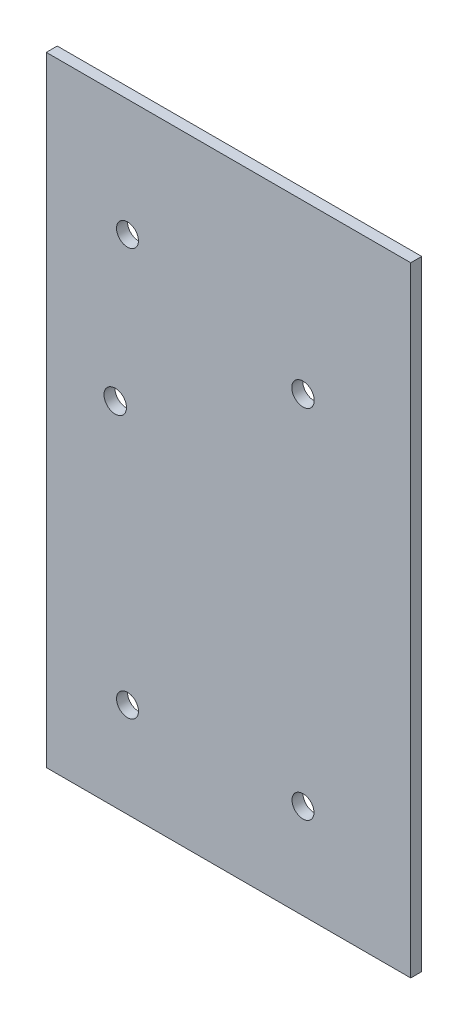
from build123d import *

# Parameters (mm, degrees)
SKETCH1_W           = 105.497827183
SKETCH1_H           = 179.29887024
SKETCH1_R           = 3.175
SKETCH1_R_2         = 3.2512
BOSS_EXTRUDE1_DEPTH = 3.175


with BuildPart() as part:
    # Sketch1 → Boss-Extrude1 (new body)
    with BuildSketch(Plane.XY):
        with Locations((54.6380005, 121.166691813)):
            Rectangle(SKETCH1_W, SKETCH1_H)
        with Locations((25.4, 58.964285714)):
            Circle(SKETCH1_R, mode=Mode.SUBTRACT)
        with Locations((76.2, 58.964285714)):
            Circle(SKETCH1_R, mode=Mode.SUBTRACT)
        with Locations((25.4, 176.892857143)):
            Circle(SKETCH1_R, mode=Mode.SUBTRACT)
        with Locations((21.844, 133.35)):
            Circle(SKETCH1_R_2, mode=Mode.SUBTRACT)
        with Locations((76.2, 162.306)):
            Circle(SKETCH1_R_2, mode=Mode.SUBTRACT)
    extrude(amount=BOSS_EXTRUDE1_DEPTH)


solid = part.part
